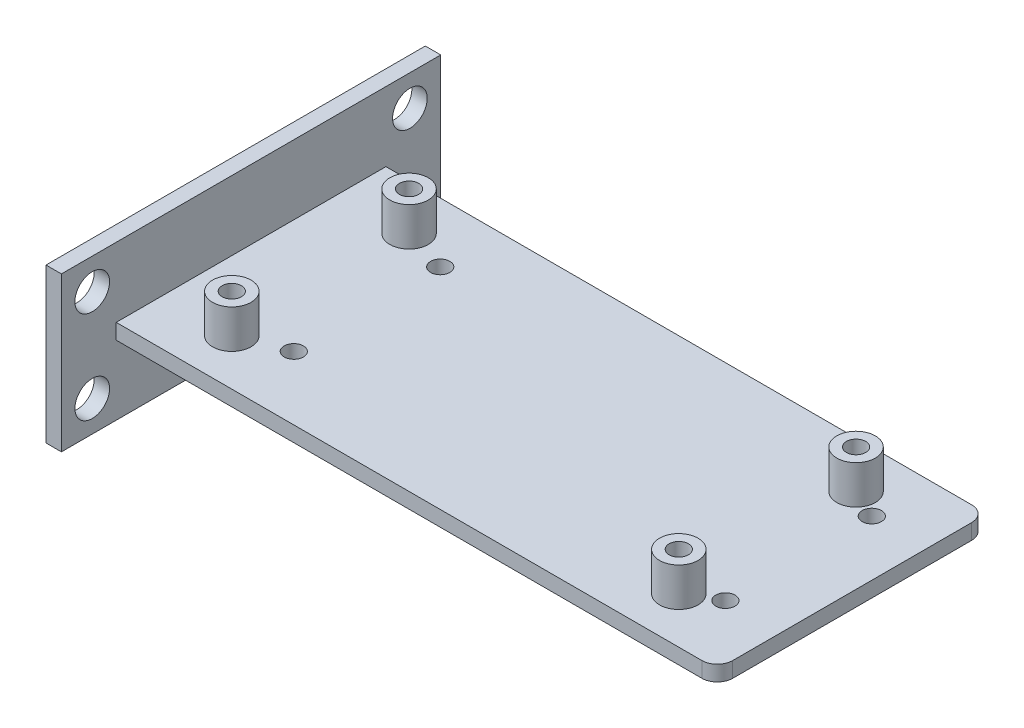
from build123d import *

# Parameters (mm, degrees)
SKETCH_1_W               = 80
SKETCH_1_H               = 35
EXTRUDE_1_DEPTH          = 2
SKETCH_2_R               = 2.5
EXTRUDE_2_DEPTH          = 5
CUT_EXTRUDE_1_DEPTH      = 88.601369852
CUT_EXTRUDE_1_DEPTH_BACK = 88.601369852
SKETCH_3_R               = 1.25
FILLET_1_R               = 2
FILLET_2_R               = 2
FILLET_3_R               = 2
FILLET_4_R               = 2
SKETCH_5_R               = 1.25
CUT_EXTRUDE_3_DEPTH      = 10
EXTRUDE_START            = 4
SKETCH_6_R               = 2.5
SKETCH_6_R_2             = 1.25
EXTRUDE_3_DEPTH          = 4
SKETCH_7_W               = 49.218742156
SKETCH_7_H               = 20
SKETCH_7_R               = 2.25
EXTRUDE_4_DEPTH          = 2


with BuildPart() as part:
    # Эскиз1 → Бобышка-Вытянуть1 (new body)
    with BuildSketch(Plane(origin=(0, 0, 0), x_dir=(1, 0, 0), z_dir=(0, 1, 0))):
        with Locations((40, -17.5)):
            Rectangle(SKETCH_1_W, SKETCH_1_H)
    extrude(amount=EXTRUDE_1_DEPTH)

    # Эскиз2 → Бобышка-Вытянуть2 (add)
    with BuildSketch(Plane(origin=(0, 2, 0), x_dir=(1, 0, 0), z_dir=(0, 1, 0))):
        with Locations((11, -6)):
            Circle(SKETCH_2_R)
        with Locations((11, -29)):
            Circle(SKETCH_2_R)
        with Locations((69, -6)):
            Circle(SKETCH_2_R)
        with Locations((69, -29)):
            Circle(SKETCH_2_R)
    extrude(amount=EXTRUDE_2_DEPTH)

    # Эскиз3 → Вырез-Вытянуть1 (cut, two sides: drawn at the far end of the back side and taken through both)
    with BuildSketch(Plane(origin=(0, 7, 0), x_dir=(1, 0, 0), z_dir=(0, 1, 0)).offset(-CUT_EXTRUDE_1_DEPTH_BACK)):
        with Locations((11, -6)):
            Circle(SKETCH_3_R)
        with Locations((11, -29)):
            Circle(SKETCH_3_R)
        with Locations((69, -6)):
            Circle(SKETCH_3_R)
        with Locations((69, -29)):
            Circle(SKETCH_3_R)
    extrude(amount=CUT_EXTRUDE_1_DEPTH + CUT_EXTRUDE_1_DEPTH_BACK, mode=Mode.SUBTRACT)

    # Скругление1
    fillet_1_edges = [part.edges().sort_by_distance(p)[0] for p in [
        (0, 1, 0),
    ]]
    fillet(fillet_1_edges, radius=FILLET_1_R)

    # Скругление2
    fillet_2_edges = [part.edges().sort_by_distance(p)[0] for p in [
        (0, 1, 35),
    ]]
    fillet(fillet_2_edges, radius=FILLET_2_R)

    # Скругление3
    fillet_3_edges = [part.edges().sort_by_distance(p)[0] for p in [
        (80, 1, 35),
    ]]
    fillet(fillet_3_edges, radius=FILLET_3_R)

    # Скругление4
    fillet_4_edges = [part.edges().sort_by_distance(p)[0] for p in [
        (80, 1, 0),
    ]]
    fillet(fillet_4_edges, radius=FILLET_4_R)

    # Эскиз5 → Вырез-Вытянуть3 (cut)
    with BuildSketch(Plane.XZ):
        with Locations((16.789329721, 26.745983075)):
            Circle(SKETCH_5_R)
        with Locations((72.789329721, 26.745983075)):
            Circle(SKETCH_5_R)
        with Locations((72.789329721, 7.745983075)):
            Circle(SKETCH_5_R)
        with Locations((16.789329721, 7.745983075)):
            Circle(SKETCH_5_R)
    extrude(amount=-CUT_EXTRUDE_3_DEPTH, mode=Mode.SUBTRACT)

    # Эскиз6 → Бобышка-Вытянуть3 (add)
    # profile 1 of 4: a face of its own
    with BuildSketch(Plane.XZ.offset(EXTRUDE_START)):
        with Locations((16.789329721, 26.745983075)):
            Circle(SKETCH_6_R)
        with Locations((16.789329721, 26.745983075)):
            Circle(SKETCH_6_R_2, mode=Mode.SUBTRACT)
    # profile 2 of 4: a face of its own
    with BuildSketch(Plane.XZ.offset(EXTRUDE_START)):
        with Locations((72.789329721, 26.745983075)):
            Circle(SKETCH_6_R)
        with Locations((72.789329721, 26.745983075)):
            Circle(SKETCH_6_R_2, mode=Mode.SUBTRACT)
    # profile 3 of 4: a face of its own
    with BuildSketch(Plane.XZ.offset(EXTRUDE_START)):
        with Locations((72.789329721, 7.745983075)):
            Circle(SKETCH_6_R)
        with Locations((72.789329721, 7.745983075)):
            Circle(SKETCH_6_R_2, mode=Mode.SUBTRACT)
    # profile 4 of 4: a face of its own
    with BuildSketch(Plane.XZ.offset(EXTRUDE_START)):
        with Locations((16.789329721, 7.745983075)):
            Circle(SKETCH_6_R)
        with Locations((16.789329721, 7.745983075)):
            Circle(SKETCH_6_R_2, mode=Mode.SUBTRACT)
    extrude(amount=-EXTRUDE_3_DEPTH)

    # Эскиз7 → Бобышка-Вытянуть4 (add)
    with BuildSketch(Plane.ZY):
        with Locations((17.5, 1)):
            Rectangle(SKETCH_7_W, SKETCH_7_H)
        with Locations((38.109371078, -5)):
            Circle(SKETCH_7_R, mode=Mode.SUBTRACT)
        with Locations((-3.109371078, -5)):
            Circle(SKETCH_7_R, mode=Mode.SUBTRACT)
        with Locations((-3.109371078, 7)):
            Circle(SKETCH_7_R, mode=Mode.SUBTRACT)
        with Locations((38.109371078, 7)):
            Circle(SKETCH_7_R, mode=Mode.SUBTRACT)
    extrude(amount=-EXTRUDE_4_DEPTH)


solid = part.part
